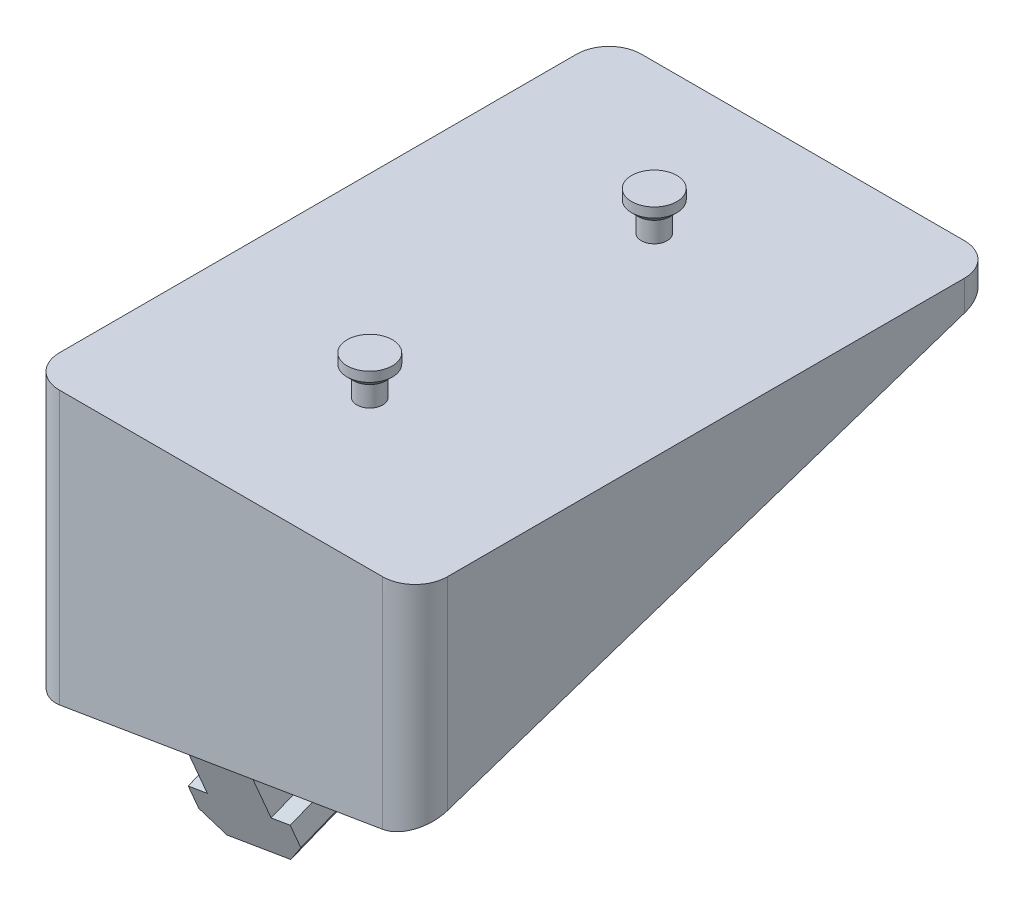
from build123d import *

# Parameters (mm, degrees)
BOSS_EXTRUDE1_DEPTH      = 1
BOSS_EXTRUDE1_DEPTH_BACK = 2
SKETCH1_W                = 60
SKETCH1_H                = 90
SKETCH2_R                = 2
BOSS_EXTRUDE2_DEPTH      = 3.5
SKETCH3_R                = 3.5
BOSS_EXTRUDE3_DEPTH      = 2.5
CHAMFER1_SIZE            = 1
BOSS_EXTRUDE5_REACH      = 138.434
SKETCH1_3_W              = 60
SKETCH1_3_H              = 90
BOSS_EXTRUDE6_REACH      = 116.794
CHAMFER2_SIZE            = 3
FILLET1_R                = 5


with BuildPart() as part:
    # Sketch1 → Boss-Extrude1 (new, two sides: drawn at the far end of the back side and taken through both)
    with BuildSketch(Plane(origin=(0, 0, 0), x_dir=(1, 0, 0), z_dir=(0, 1, 0)).offset(-BOSS_EXTRUDE1_DEPTH_BACK)):
        with Locations((30, -45)):
            Rectangle(SKETCH1_W, SKETCH1_H)
    extrude(amount=BOSS_EXTRUDE1_DEPTH + BOSS_EXTRUDE1_DEPTH_BACK)

    # Sketch2 → Boss-Extrude2 (add)
    with BuildSketch(Plane(origin=(0, 1, 0), x_dir=(1, 0, 0), z_dir=(0, 1, 0))):
        with Locations((30, -23)):
            Circle(SKETCH2_R)
        with Locations((30, -67)):
            Circle(SKETCH2_R)
    extrude(amount=BOSS_EXTRUDE2_DEPTH)

    # Sketch3 → Boss-Extrude3 (add)
    with BuildSketch(Plane(origin=(0, 4.5, 0), x_dir=(1, 0, 0), z_dir=(0, 1, 0))):
        with Locations((30, -23)):
            Circle(SKETCH3_R)
        with Locations((30, -67)):
            Circle(SKETCH3_R)
    extrude(amount=BOSS_EXTRUDE3_DEPTH)

    # Chamfer1
    chamfer1_edges = [part.edges().sort_by_distance(p)[0] for p in [
        (26.5, 4.5, 23),
        (26.5, 4.5, 67),
    ]]
    chamfer(chamfer1_edges, length=CHAMFER1_SIZE)

    # Boss-Extrude5: up to this plane
    boss_extrude5_end = Plane(origin=(1.756097561, -10.536585366, -3.512195122), z_dir=(0.1561737618886063, -0.9370425713316366, -0.3123475237772119))
    # Sketch1<3> → Boss-Extrude5 (add, up to the surface)
    with BuildSketch(Plane(origin=(0, 0, 0), x_dir=(1, 0, 0), z_dir=(0, 1, 0)), mode=Mode.PRIVATE) as boss_extrude5_sk1:
        with Locations((30, -45)):
            Rectangle(SKETCH1_3_W, SKETCH1_3_H)
    boss_extrude5_tool1 = split(extrude(boss_extrude5_sk1.sketch, amount=-BOSS_EXTRUDE5_REACH, mode=Mode.PRIVATE), bisect_by=boss_extrude5_end, keep=Keep.BOTH, mode=Mode.PRIVATE)
    add(boss_extrude5_tool1.solids().sort_by_distance((30, 0, 45))[0])

    # Boss-Extrude6: up to this plane
    boss_extrude6_end = Plane(origin=(0, -2, 0), z_dir=(0, 0, -1))
    # Sketch11 → Boss-Extrude6 (add, up to the surface)
    with BuildSketch(Plane(origin=(5.05471325, -30.328279499, 93.512195122), x_dir=(-0.9986694407655652, -0.011316895385518406, 0.05031178748391653), z_dir=(-0.05134961659630974, 0.3080976995778579, -0.9499679070317293)), mode=Mode.PRIVATE) as boss_extrude6_sk1:
        Polygon((-20.078587448, -8.116309156), (-29.948006992, -6.505546026), (-30.91446487, -12.427197753), (-33.875290733, -11.943968814), (-34.922286767, -18.359091518), (-19.131215496, -20.936312525), (-18.084219462, -14.521189821), (-21.045045326, -14.037960882), align=None)
    boss_extrude6_tool1 = split(extrude(boss_extrude6_sk1.sketch, amount=BOSS_EXTRUDE6_REACH, mode=Mode.PRIVATE), bisect_by=boss_extrude6_end, keep=Keep.BOTH, mode=Mode.PRIVATE)
    add(boss_extrude6_tool1.solids().sort_by_distance((31.087503, -43.525016, 87.824995))[0])

    # Chamfer2
    chamfer2_edges = [part.edges().sort_by_distance(p)[0] for p in [
        (37.516413794, -33.436382521, 43.047827976),
        (21.734111013, -36.066766318, 43.047827976),
    ]]
    chamfer(chamfer2_edges, length=CHAMFER2_SIZE)

    # Fillet1
    fillet1_edges = [part.edges().sort_by_distance(p)[0] for p in [
        (60, -0.5, 0),
        (0, -5.5, 0),
        (60, -15.5, 90),
        (0, -20.5, 90),
    ]]
    fillet(fillet1_edges, radius=FILLET1_R)


solid = part.part
